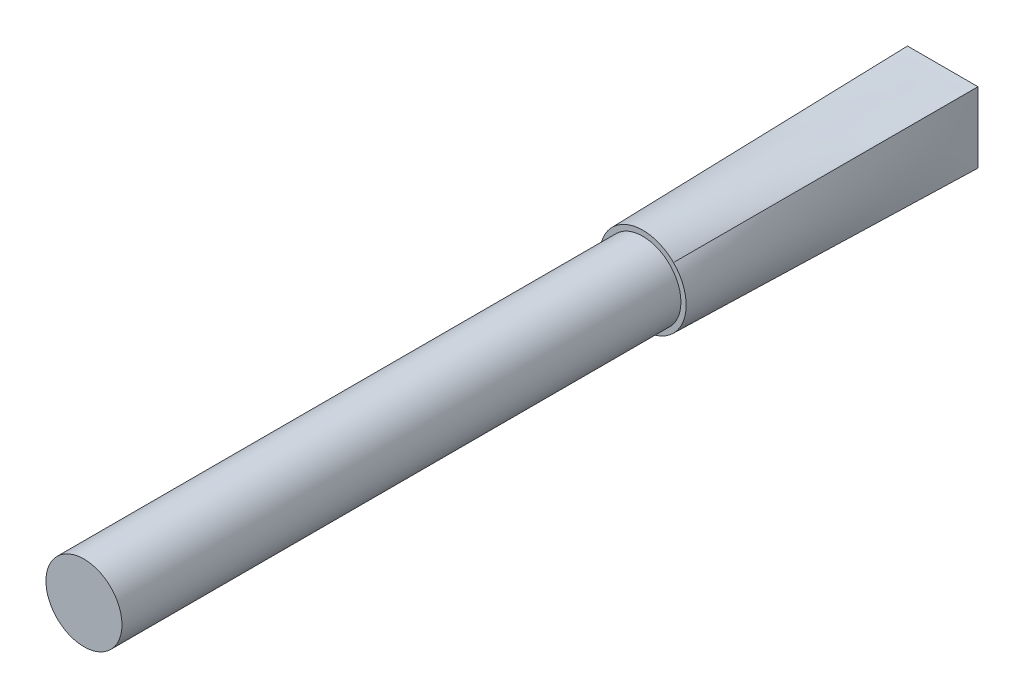
from build123d import *

# Parameters (mm, degrees)
SKETCH1_R           = 6.15
BOSS_EXTRUDE1_DEPTH = 17
BOSS_EXTRUDE2_START = -73.4
SKETCH1_2_R         = 6.15
BOSS_EXTRUDE2_DEPTH = 73.4
SKETCH4_W           = 9.7
SKETCH4_H           = 9.7
CUT_EXTRUDE1_DEPTH  = 1.5
FILLET1_R           = 1


with BuildPart() as part:
    # Sketch1 → Boss-Extrude1 (new body)
    with BuildSketch(Plane.XY):
        with Locations((-46.956139987, 36.685790659)):
            Circle(SKETCH1_R)
    extrude(amount=BOSS_EXTRUDE1_DEPTH)

    # Sketch1<2> → Boss-Extrude2 (add)
    with BuildSketch(Plane.XY.offset(BOSS_EXTRUDE2_START)):
        with Locations((-46.956139987, 36.685790659)):
            Circle(SKETCH1_2_R)
    extrude(amount=BOSS_EXTRUDE2_DEPTH)

    # Sketch3 → Loft1 section 0
    with BuildSketch(Plane(origin=(0, 0, -121.9), x_dir=(-1, 0, 0), z_dir=(0, 0, -1))):
        with BuildLine():
            Line((41.256139987, 42.385790659), (52.656139987, 42.385790659))
            Line((52.656139987, 42.385790659), (52.656139987, 30.985790659))
            Line((52.656139987, 30.985790659), (41.256139987, 30.985790659))
            Line((41.256139987, 30.985790659), (41.256139987, 42.385790659))
        make_face()
    # Sketch2 for Loft1 → Loft1 section 1
    with BuildSketch(Plane(origin=(0, 0, -73.4), x_dir=(-1, 0, 0), z_dir=(0, 0, -1))):
        with BuildLine():
            # circular arc as an exact rational Bezier (weights 1, cos(half-angle), 1)
            Bezier((42.006392519, 41.635538128), (46.956139988, 46.585285594), (51.905887456, 41.635538128), weights=[1, 0.707106781, 1])
            Bezier((51.905887456, 41.635538128), (56.855634922, 36.68579066), (51.905887456, 31.736043191), weights=[1, 0.707106781, 1])
            Bezier((51.905887456, 31.736043191), (46.956139987, 26.786295722), (42.006392519, 31.736043191), weights=[1, 0.707106781, 1])
            Bezier((42.006392519, 31.736043191), (37.05664505, 36.685790659), (42.006392519, 41.635538128), weights=[1, 0.707106781, 1])
        make_face()
    loft()

    # Sketch4 → Cut-Extrude1 (cut)
    with BuildSketch(Plane(origin=(0, 0, -121.9), x_dir=(-1, 0, 0), z_dir=(0, 0, -1))):
        with Locations((46.956139987, 36.685790659)):
            Rectangle(SKETCH4_W, SKETCH4_H)
    extrude(amount=-CUT_EXTRUDE1_DEPTH, mode=Mode.SUBTRACT)

    # Fillet1
    fillet1_edges = [part.edges().sort_by_distance(p)[0] for p in [
        (-51.806139987, 41.535790659, -121.15),
        (-51.806139987, 31.835790659, -121.15),
        (-42.106139987, 41.535790659, -121.15),
        (-42.106139987, 31.835790659, -121.15),
    ]]
    fillet(fillet1_edges, radius=FILLET1_R)


solid = part.part
